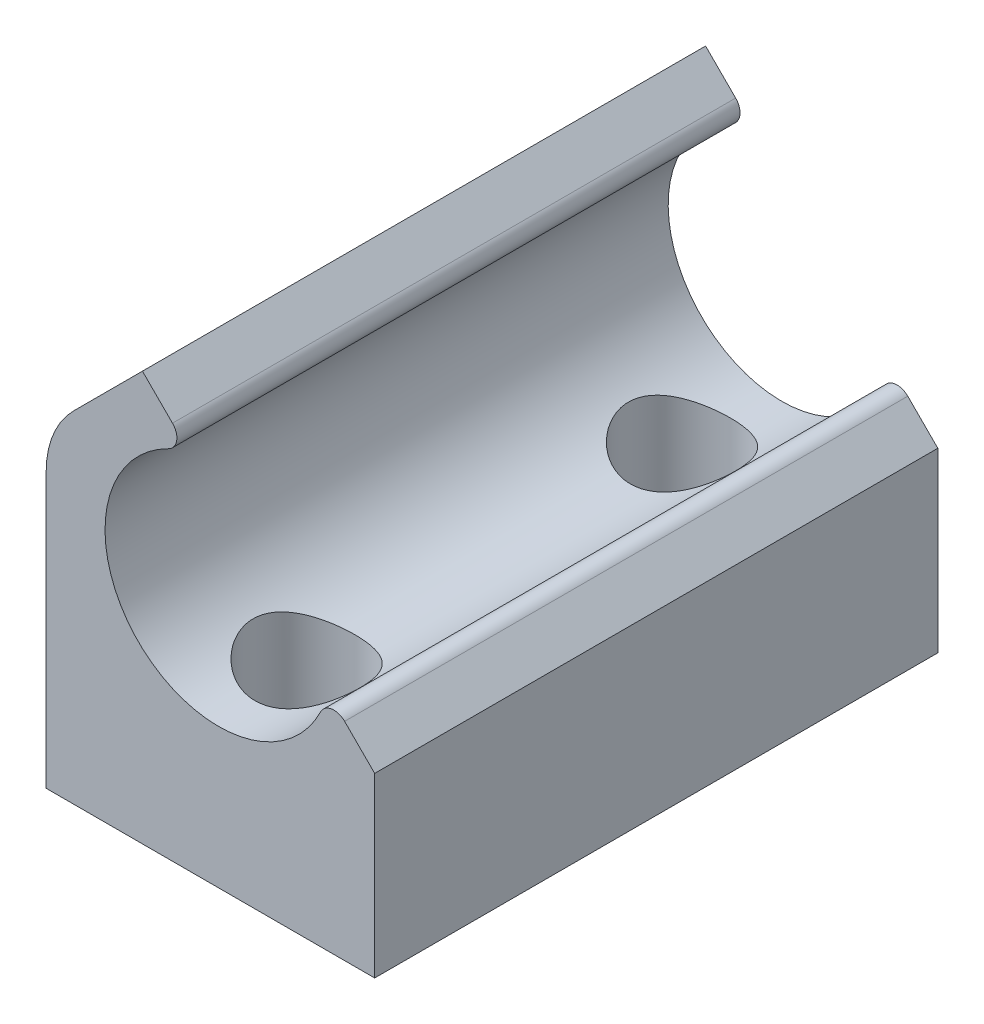
from build123d import *

# Parameters (mm, degrees)
BOSS_EXTRUDE1_DEPTH = 30
FILLET1_R           = 0.8
SKETCH3_R           = 2.85
CUT_EXTRUDE1_DEPTH  = 9
SKETCH4_R           = 1.55
CUT_EXTRUDE2_DEPTH  = 37.426390381
FILLET2_R           = 5


with BuildPart() as part:
    # Sketch1 → Boss-Extrude1 (new body)
    with BuildSketch(Plane.XY):
        with BuildLine():
            Line((0, 0), (17.5, 0))
            Line((17.5, 0), (17.5, 9.44))
            Line((17.5, 9.44), (15.025126266, 11.914873734))
            ThreePointArc((15.025126266, 11.914873734), (4.907782078, 9.219443047), (7.603212766, 19.336787234))
            Line((7.603212766, 19.336787234), (5.128339032, 21.811660968))
            Line((5.128339032, 21.811660968), (0, 16.683321936))
            Line((0, 16.683321936), (0, 0))
        make_face()
    extrude(amount=BOSS_EXTRUDE1_DEPTH)

    # Fillet1
    fillet1_edges = [part.edges().sort_by_distance(p)[0] for p in [
        (15.025126266, 11.914873734, 15),
        (7.603212766, 19.336787234, 15),
    ]]
    fillet(fillet1_edges, radius=FILLET1_R)

    # Sketch3 → Cut-Extrude1 (cut)
    with BuildSketch(Plane(origin=(0, 10.828405067, 0), x_dir=(-1, 0, 0), z_dir=(0, -1, 0))):
        with Locations((-8.875495285, -5)):
            Circle(SKETCH3_R)
        with Locations((-8.875495285, -25)):
            Circle(SKETCH3_R)
    extrude(amount=CUT_EXTRUDE1_DEPTH, mode=Mode.SUBTRACT)

    # Sketch4 → Cut-Extrude2 (cut, through all)
    with BuildSketch(Plane(origin=(0, 10.828405067, 0), x_dir=(-1, 0, 0), z_dir=(0, -1, 0))):
        with Locations((-8.875495285, -5)):
            Circle(SKETCH4_R)
        with Locations((-8.875495285, -25)):
            Circle(SKETCH4_R)
    extrude(amount=CUT_EXTRUDE2_DEPTH, mode=Mode.SUBTRACT)

    # Fillet2
    fillet2_edges = [part.edges().sort_by_distance(p)[0] for p in [
        (0, 16.683321936, 15),
    ]]
    fillet(fillet2_edges, radius=FILLET2_R)


solid = part.part
